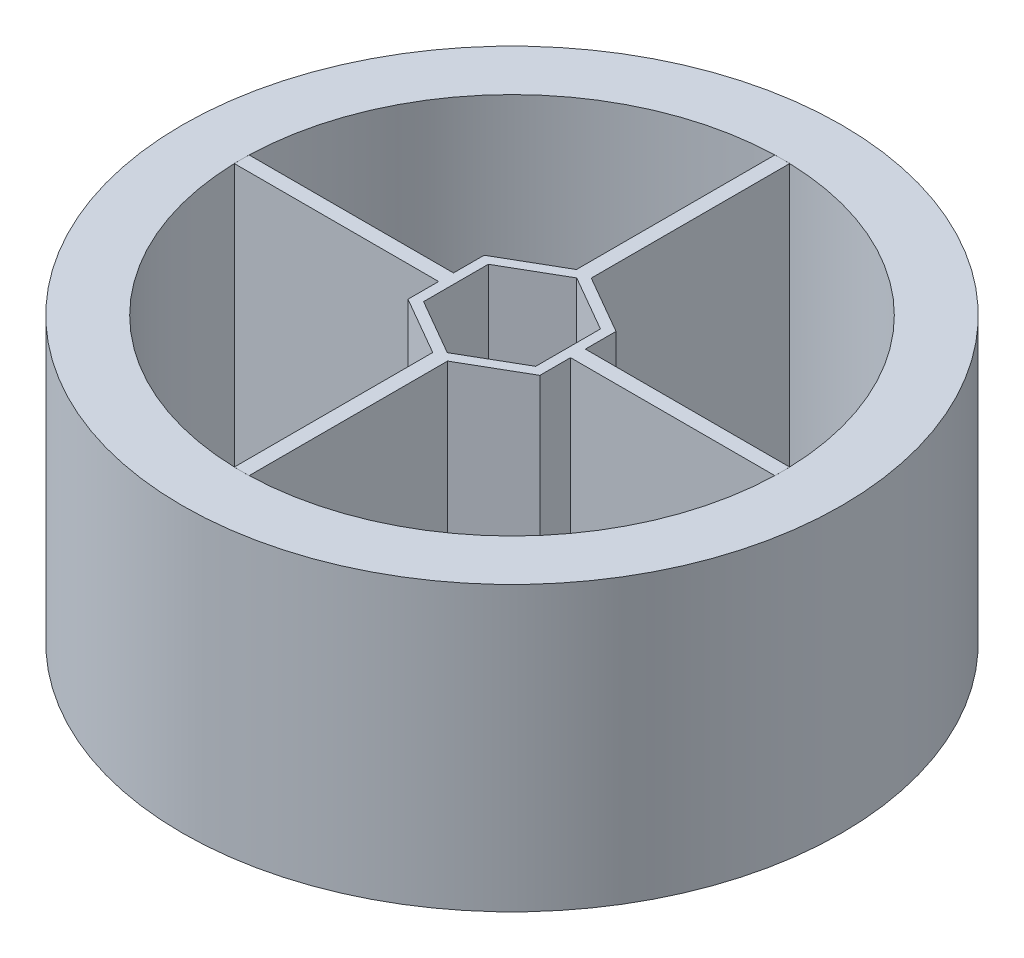
from build123d import *

# Parameters (mm, degrees)
MAIN_WHEEL_DEPTH   = 43
SKETCH1_R          = 50
MAIN_WHEEL_2_DEPTH = 43
HEX_BORE_DEPTH     = 23
SKETCH3_R          = 2.5
MOTOR_BORE_DEPTH   = 75.35724578


with BuildPart() as part:
    # Sketch1 → main-wheel (new body)
    with BuildSketch(Plane(origin=(0, 0, 0), x_dir=(1, 0, 0), z_dir=(0, 1, 0))):
        with BuildLine():
            Line((-1.125, -10.897486331), (-1.125, -40.984562643))
            ThreePointArc((-1.125, -40.984562643), (-0.562552934, -40.996140479), (4.4e-08, -41))
            ThreePointArc((4.4e-08, -41), (0.562552978, -40.996140479), (1.125, -40.984562643))
            Line((1.125, -40.984562643), (1.125, -10.897486331))
            Line((1.125, -10.897486331), (10, -5.773502692))
            Line((10, -5.773502692), (10, -1.125))
            Line((10, -1.125), (40.984562643, -1.125))
            ThreePointArc((40.984562643, -1.125), (40.996140479, -0.562552956), (41, 0))
            ThreePointArc((41, 0), (40.996140479, 0.562552956), (40.984562643, 1.125))
            Line((40.984562643, 1.125), (10, 1.125))
            Line((10, 1.125), (10, 5.773502692))
            Line((10, 5.773502692), (1.125, 10.897486331))
            Line((1.125, 10.897486331), (1.125, 40.984562643))
            ThreePointArc((1.125, 40.984562643), (0.562552956, 40.996140479), (0, 41))
            ThreePointArc((0, 41), (-0.562552956, 40.996140479), (-1.125, 40.984562643))
            Line((-1.125, 40.984562643), (-1.125, 10.897486331))
            Line((-1.125, 10.897486331), (-10, 5.773502692))
            Line((-10, 5.773502692), (-10, 1.125))
            Line((-10, 1.125), (-40.984562643, 1.125))
            ThreePointArc((-40.984562643, 1.125), (-40.996140481, 0.562552814), (-41, -2.83e-07))
            ThreePointArc((-41, -2.83e-07), (-40.996140477, -0.562553097), (-40.984562643, -1.125))
            Line((-40.984562643, -1.125), (-10, -1.125))
            Line((-10, -1.125), (-10, -5.773502692))
            Line((-10, -5.773502692), (-1.125, -10.897486331))
        make_face()
    extrude(amount=MAIN_WHEEL_DEPTH)

    # Sketch2 → hex-bore (cut)
    with BuildSketch(Plane(origin=(0, 43, 0), x_dir=(1, 0, 0), z_dir=(0, 1, 0))):
        Polygon((0, -9.814954576), (8.5, -4.907477288), (8.5, 4.907477288), (0, 9.814954576), (-8.5, 4.907477288), (-8.5, -4.907477288), align=None)
    extrude(amount=-HEX_BORE_DEPTH, mode=Mode.SUBTRACT)

    # Sketch3 → motor-bore (cut, through all)
    with BuildSketch(Plane(origin=(0, 20, 0), x_dir=(1, 0, 0), z_dir=(0, 1, 0))):
        Circle(SKETCH3_R)
    extrude(amount=-MOTOR_BORE_DEPTH, mode=Mode.SUBTRACT)


with BuildPart() as body_2:
    # Sketch1 → main-wheel 2 (new body)
    with BuildSketch(Plane(origin=(0, 0, 0), x_dir=(1, 0, 0), z_dir=(0, 1, 0))):
        Circle(SKETCH1_R)
        with BuildLine():
            Line((4.4e-08, -41), (-1.125, -41))
            Line((-1.125, -41), (-1.125, -40.984562643))
            ThreePointArc((-1.125, -40.984562643), (-28.991378029, -28.991378029), (-40.984562643, -1.125))
            Line((-40.984562643, -1.125), (-41, -1.125))
            Line((-41, -1.125), (-41, -2.83e-07))
            Line((-41, -2.83e-07), (-41, 1.125))
            Line((-41, 1.125), (-40.984562643, 1.125))
            ThreePointArc((-40.984562643, 1.125), (-28.991378029, 28.991378029), (-1.125, 40.984562643))
            Line((-1.125, 40.984562643), (-1.125, 41))
            Line((-1.125, 41), (0, 41))
            Line((0, 41), (1.125, 41))
            Line((1.125, 41), (1.125, 40.984562643))
            ThreePointArc((1.125, 40.984562643), (28.991378029, 28.991378029), (40.984562643, 1.125))
            Line((40.984562643, 1.125), (41, 1.125))
            Line((41, 1.125), (41, 0))
            Line((41, 0), (41, -1.125))
            Line((41, -1.125), (40.984562643, -1.125))
            ThreePointArc((40.984562643, -1.125), (28.991378029, -28.991378029), (1.125, -40.984562643))
            Line((1.125, -40.984562643), (1.125, -41))
            Line((1.125, -41), (4.4e-08, -41))
        make_face(mode=Mode.SUBTRACT)
    extrude(amount=MAIN_WHEEL_2_DEPTH)


solid = Compound([part.part, body_2.part])
